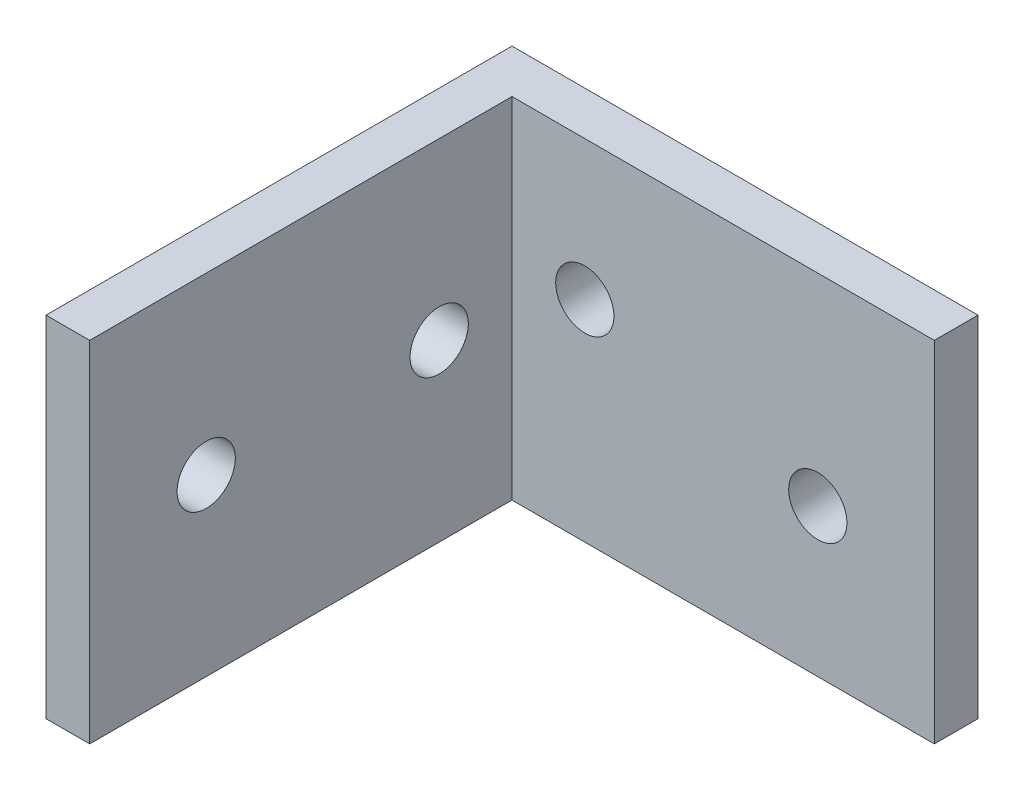
from build123d import *

# Parameters (mm, degrees)
BOSS_EXTRUDE1_DEPTH = 38.1
CUT_EXTRUDE1_REACH  = 83.32
SKETCH2_R           = 3.175
CUT_EXTRUDE2_REACH  = 83.32
SKETCH4_R           = 3.175


with BuildPart() as part:
    # Sketch1 → Boss-Extrude1 (new body)
    with BuildSketch(Plane(origin=(0, 0, 0), x_dir=(1, 0, 0), z_dir=(0, 1, 0))):
        Polygon((0, 0), (0, 50.8), (50.8, 50.8), (50.8, 46.0375), (4.7625, 46.0375), (4.7625, 0), align=None)
    extrude(amount=BOSS_EXTRUDE1_DEPTH)

    # Sketch2 → Cut-Extrude1 (cut, up to next)
    with BuildSketch(Plane(origin=(0, 0, -50.8), x_dir=(-1, 0, 0), z_dir=(0, 0, -1)), mode=Mode.PRIVATE) as cut_extrude1_sk1:
        with Locations((-12.7, 22.908864232)):
            Circle(SKETCH2_R)
    cut_extrude1_tool1 = extrude(cut_extrude1_sk1.sketch, amount=-CUT_EXTRUDE1_REACH, mode=Mode.PRIVATE) & part.part
    # Sketch2 → Cut-Extrude1 (cut, up to next)
    with BuildSketch(Plane(origin=(0, 0, -50.8), x_dir=(-1, 0, 0), z_dir=(0, 0, -1)), mode=Mode.PRIVATE) as cut_extrude1_sk2:
        with Locations((-38.1, 16.102954744)):
            Circle(SKETCH2_R)
    cut_extrude1_tool2 = extrude(cut_extrude1_sk2.sketch, amount=-CUT_EXTRUDE1_REACH, mode=Mode.PRIVATE) & part.part
    add(cut_extrude1_tool1.solids().sort_by_distance((12.7, 22.908864, -50.8))[0], mode=Mode.SUBTRACT)
    add(cut_extrude1_tool2.solids().sort_by_distance((38.1, 16.102955, -50.8))[0], mode=Mode.SUBTRACT)

    # Sketch4 → Cut-Extrude2 (cut, up to next)
    with BuildSketch(Plane.ZY, mode=Mode.PRIVATE) as cut_extrude2_sk1:
        with Locations((-12.7, 19.05)):
            Circle(SKETCH4_R)
    cut_extrude2_tool1 = extrude(cut_extrude2_sk1.sketch, amount=-CUT_EXTRUDE2_REACH, mode=Mode.PRIVATE) & part.part
    # Sketch4 → Cut-Extrude2 (cut, up to next)
    with BuildSketch(Plane.ZY, mode=Mode.PRIVATE) as cut_extrude2_sk2:
        with Locations((-38.1, 19.05)):
            Circle(SKETCH4_R)
    cut_extrude2_tool2 = extrude(cut_extrude2_sk2.sketch, amount=-CUT_EXTRUDE2_REACH, mode=Mode.PRIVATE) & part.part
    add(cut_extrude2_tool1.solids().sort_by_distance((0, 19.05, -12.7))[0], mode=Mode.SUBTRACT)
    add(cut_extrude2_tool2.solids().sort_by_distance((0, 19.05, -38.1))[0], mode=Mode.SUBTRACT)


solid = part.part
